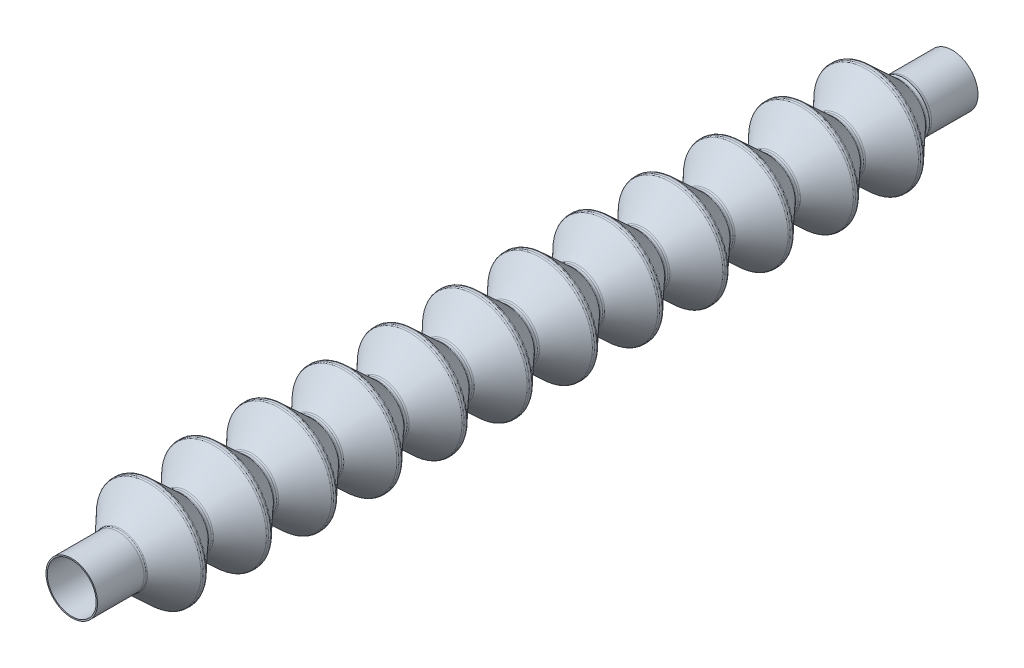
from build123d import *

# Parameters (mm, degrees)
SKETCH5_W = 19.05
SKETCH5_H = 0.508
FILLET3_R = 2.54
FILLET1_R = 0.889
FILLET2_R = 0.889


with BuildPart() as part:
    # Sketch2 → Revolve3 (revolve)
    with BuildSketch(Plane(origin=(0, 0, 0), x_dir=(0, 0, -1), z_dir=(1, 0, 0)), mode=Mode.PRIVATE) as revolve3_sk:
        Polygon((-152.4, 10.219485369), (-141.224, 20.6375), (-139.7, 20.6375), (-128.524, 10.219485369), (-127, 10.219485369), (-115.824, 20.6375), (-114.3, 20.6375), (-103.124, 10.219485369), (-101.6, 10.219485369), (-90.424, 20.6375), (-88.9, 20.6375), (-77.724, 10.219485369), (-76.2, 10.219485369), (-65.024, 20.6375), (-63.5, 20.6375), (-52.324, 10.219485369), (-50.8, 10.219485369), (-39.624, 20.6375), (-38.1, 20.6375), (-26.924, 10.219485369), (-25.4, 10.219485369), (-14.224, 20.6375), (-12.7, 20.6375), (-1.524, 10.219485369), (0, 10.219485369), (11.176, 20.6375), (12.7, 20.6375), (23.876, 10.219485369), (25.4, 10.219485369), (36.576, 20.6375), (38.1, 20.6375), (49.276, 10.219485369), (50.8, 10.219485369), (61.976, 20.6375), (63.5, 20.6375), (74.676, 10.219485369), (76.2, 10.219485369), (87.376, 20.6375), (88.9, 20.6375), (100.076, 10.219485369), (101.6, 10.219485369), (112.776, 20.6375), (114.3, 20.6375), (125.476, 10.219485369), (127, 10.219485369), (138.176, 20.6375), (139.7, 20.6375), (150.876, 10.219485369), (152.4, 10.219485369), (152.4, 9.525), (150.876, 9.525), (139.7, 19.943014631), (138.176, 19.943014631), (127, 9.525), (125.476, 9.525), (114.3, 19.943014631), (112.776, 19.943014631), (101.6, 9.525), (100.076, 9.525), (88.9, 19.943014631), (87.376, 19.943014631), (76.2, 9.525), (74.676, 9.525), (63.5, 19.943014631), (61.976, 19.943014631), (50.8, 9.525), (49.276, 9.525), (38.1, 19.943014631), (36.576, 19.943014631), (25.4, 9.525), (23.876, 9.525), (12.7, 19.943014631), (11.176, 19.943014631), (0, 9.525), (-1.524, 9.525), (-12.7, 19.943014631), (-14.224, 19.943014631), (-25.4, 9.525), (-26.924, 9.525), (-38.1, 19.943014631), (-39.624, 19.943014631), (-50.8, 9.525), (-52.324, 9.525), (-63.5, 19.943014631), (-65.024, 19.943014631), (-76.2, 9.525), (-77.724, 9.525), (-88.9, 19.943014631), (-90.424, 19.943014631), (-101.6, 9.525), (-103.124, 9.525), (-114.3, 19.943014631), (-115.824, 19.943014631), (-127, 9.525), (-128.524, 9.525), (-139.7, 19.943014631), (-141.224, 19.943014631), (-152.4, 9.525), align=None)
    revolve(revolve3_sk.sketch.rotate(Axis((0, 0, 152.4), (0, 0, -1)), 180), axis=Axis((0, 0, 152.4), (0, 0, -1)))

    # Sketch5 → Revolve2 (revolve)
    with BuildSketch(Plane(origin=(0, 0, 0), x_dir=(0, 0, -1), z_dir=(1, 0, 0))):
        with Locations((-161.925, 9.779)):
            Rectangle(SKETCH5_W, SKETCH5_H)
        with Locations((161.925, 9.779)):
            Rectangle(SKETCH5_W, SKETCH5_H)
    revolve(axis=Axis((0, 0, 152.4), (0, 0, 1)))

    # Fillet3
    # the kernel refuses this fillet: 2.54 mm, written as the material it adds along each edge
    with BuildSketch(Plane(origin=(0, 0, 152.4), x_dir=(0, 1, 0), z_dir=(1, 0, 0))) as fillet3_piece_1:
        with BuildLine():
            CenterArc((12.573, 0.955284712), FILLET3_R, 180, 22.092089756)
            Line((10.033, 0.955284712), (9.9822, 0.955284712))
            Line((9.9822, 0.955284712), (9.9822, 0))
            Line((9.9822, 0), (10.033, -0.0508))
            ThreePointArc((10.033, -0.0508), (10.126242684, -0.0508), (10.172415076, -0.019105694))
            Line((10.172415076, -0.019105694), (10.219485369, 0))
        make_face()
    revolve(axis=Axis((0, 0, 152.4), (0, 0, 1)))
    with BuildSketch(Plane(origin=(0, 0, -152.4), x_dir=(0, 1, 0), z_dir=(1, 0, 0))) as fillet3_piece_2:
        with BuildLine():
            CenterArc((12.573, -0.955284712), FILLET3_R, 157.907910244, 22.092089756)
            Line((10.033, -0.955284712), (9.9822, -0.955284712))
            Line((9.9822, -0.955284712), (9.9822, 0))
            Line((9.9822, 0), (10.033, 0.0508))
            ThreePointArc((10.033, 0.0508), (10.126242684, 0.0508), (10.172415076, 0.019105694))
            Line((10.172415076, 0.019105694), (10.219485369, 0))
        make_face()
    revolve(axis=Axis((0, 0, -152.4), (0, 0, 1)))

    # Fillet1
    fillet1_edges = [part.edges().sort_by_distance(p)[0] for p in [
        (0, 10.219485369, -150.876),
        (0, 20.6375, -139.7),
        (0, 10.219485369, -125.476),
        (0, 20.6375, -114.3),
        (0, 10.219485369, -100.076),
        (0, 20.6375, -88.9),
        (0, 10.219485369, -74.676),
        (0, 20.6375, -63.5),
        (0, 10.219485369, -49.276),
        (0, 20.6375, -38.1),
        (0, 10.219485369, -23.876),
        (0, 20.6375, -12.7),
        (0, 10.219485369, 1.524),
        (0, 20.6375, 12.7),
        (0, 10.219485369, 26.924),
        (0, 20.6375, 38.1),
        (0, 10.219485369, 52.324),
        (0, 20.6375, 63.5),
        (0, 10.219485369, 77.724),
        (0, 20.6375, 88.9),
        (0, 10.219485369, 103.124),
        (0, 20.6375, 114.3),
        (0, 10.219485369, 128.524),
        (0, 20.6375, 139.7),
    ]]
    fillet(fillet1_edges, radius=FILLET1_R)

    # Fillet2
    fillet2_edges = [part.edges().sort_by_distance(p)[0] for p in [
        (0, 20.6375, -138.176),
        (0, 10.219485369, -127),
        (0, 20.6375, -112.776),
        (0, 10.219485369, -101.6),
        (0, 20.6375, -87.376),
        (0, 10.219485369, -76.2),
        (0, 20.6375, -61.976),
        (0, 10.219485369, -50.8),
        (0, 20.6375, -36.576),
        (0, 10.219485369, -25.4),
        (0, 20.6375, -11.176),
        (0, 10.219485369, 0),
        (0, 20.6375, 14.224),
        (0, 10.219485369, 25.4),
        (0, 20.6375, 39.624),
        (0, 10.219485369, 50.8),
        (0, 20.6375, 65.024),
        (0, 10.219485369, 76.2),
        (0, 20.6375, 90.424),
        (0, 10.219485369, 101.6),
        (0, 20.6375, 115.824),
        (0, 10.219485369, 127),
        (0, 20.6375, 141.224),
        (-10.219485369, 0, 152.4),
    ]]
    fillet(fillet2_edges, radius=FILLET2_R)


solid = part.part
